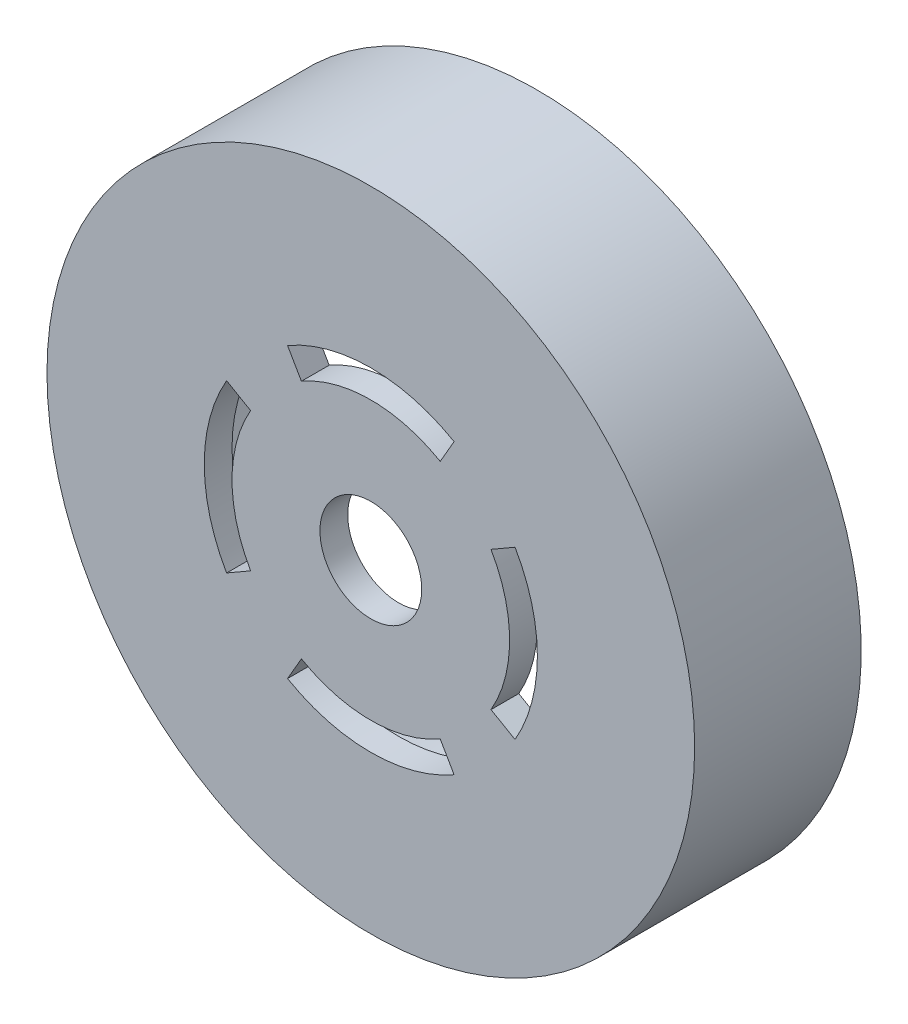
from build123d import *

# Parameters (mm, degrees)
SKETCH_2_R          = 35
SKETCH_2_R_2        = 5.5
EXTRUDE_1_DEPTH     = 5
EXTRUDE_START       = 15
SKETCH_3_R          = 35
SKETCH_3_R_2        = 30.1
EXTRUDE_2_DEPTH     = 15
SKETCH_4_R          = 1.55
CUT_EXTRUDE_1_DEPTH = 10
CUT_EXTRUDE_5_DEPTH = 15
FILLET_1_R          = 1
CUT_EXTRUDE_START   = -2
SKETCH_10_R         = 35
CUT_EXTRUDE_6_DEPTH = 2
CUT_EXTRUDE_7_DEPTH = 10


with BuildPart() as part:
    # 草图2 → 凸台-拉伸1 (new body)
    with BuildSketch(Plane.XY):
        Circle(SKETCH_2_R)
        Circle(SKETCH_2_R_2, mode=Mode.SUBTRACT)
    extrude(amount=EXTRUDE_1_DEPTH)

    # 草图3 → 凸台-拉伸2 (add)
    with BuildSketch(Plane(origin=(0, 0, 0), x_dir=(-1, 0, 0), z_dir=(0, 0, -1)).offset(EXTRUDE_START)):
        Circle(SKETCH_3_R)
        Circle(SKETCH_3_R_2, mode=Mode.SUBTRACT)
    extrude(amount=-EXTRUDE_2_DEPTH)

    # 草图4 → 切除-拉伸1 (cut)
    with BuildSketch(Plane(origin=(0, 0, -15), x_dir=(-1, 0, 0), z_dir=(0, 0, -1))):
        with Locations((0, 32.5)):
            Circle(SKETCH_4_R)
        with Locations((32.5, 0)):
            Circle(SKETCH_4_R)
        with Locations((0, -32.5)):
            Circle(SKETCH_4_R)
        with Locations((-32.5, 0)):
            Circle(SKETCH_4_R)
    extrude(amount=-CUT_EXTRUDE_1_DEPTH, mode=Mode.SUBTRACT)

    # 草图9 → 切除-拉伸5 (cut)
    with BuildSketch(Plane(origin=(0, 0, -15), x_dir=(-1, 0, 0), z_dir=(0, 0, -1))):
        with BuildLine():
            ThreePointArc((-22.013313369, 20.528615017), (-22.026376234, 22.026376234), (-20.528615017, 22.013313369))
            ThreePointArc((-20.528615017, 22.013313369), (-21.283914114, 21.283914114), (-22.013313369, 20.528615017))
        make_face()
        with BuildLine():
            ThreePointArc((20.528615017, 22.013313369), (22.026376234, 22.026376234), (22.013313369, 20.528615017))
            ThreePointArc((22.013313369, 20.528615017), (21.283914114, 21.283914114), (20.528615017, 22.013313369))
        make_face()
        with BuildLine():
            ThreePointArc((22.013313369, -20.528615017), (22.026376234, -22.026376234), (20.528615017, -22.013313369))
            ThreePointArc((20.528615017, -22.013313369), (21.283914114, -21.283914114), (22.013313369, -20.528615017))
        make_face()
        with BuildLine():
            ThreePointArc((-20.528615017, -22.013313369), (-22.026376234, -22.026376234), (-22.013313369, -20.528615017))
            ThreePointArc((-22.013313369, -20.528615017), (-21.283914114, -21.283914114), (-20.528615017, -22.013313369))
        make_face()
    extrude(amount=-CUT_EXTRUDE_5_DEPTH, mode=Mode.SUBTRACT)

    # 圆角1
    # the kernel refuses this fillet: 1 mm, written as the material it takes off along each edge
    with BuildSketch(Plane(origin=(0, 0, -15), x_dir=(-0.7403558797037455, 0.6722151228498904, 0), z_dir=(-0.6722151228498904, -0.7403558797037455, 0))) as fillet_1_piece_1:
        with BuildLine():
            CenterArc((30.1 + FILLET_1_R, -FILLET_1_R), FILLET_1_R, 90, 90)
            Line((30.1, -FILLET_1_R), (30.1, 0))
            Line((30.1, 0), (30.1 + FILLET_1_R, 0))
        make_face()
    revolve(axis=Axis((0, 0, -15), (0, 0, -1)), revolution_arc=95.523479776, mode=Mode.SUBTRACT)
    with BuildSketch(Plane(origin=(0, 0, -15), x_dir=(0.6722151228498918, 0.7403558797037441, 0), z_dir=(-0.7403558797037441, 0.6722151228498918, 0))) as fillet_1_piece_2:
        with BuildLine():
            CenterArc((30.1 + FILLET_1_R, -FILLET_1_R), FILLET_1_R, 90, 90)
            Line((30.1, -FILLET_1_R), (30.1, 0))
            Line((30.1, 0), (30.1 + FILLET_1_R, 0))
        make_face()
    revolve(axis=Axis((0, 0, -15), (0, 0, -1)), revolution_arc=95.523479776, mode=Mode.SUBTRACT)
    with BuildSketch(Plane(origin=(0, 0, -15), x_dir=(0.7403558797037453, -0.6722151228498905, 0), z_dir=(0.6722151228498905, 0.7403558797037453, 0))) as fillet_1_piece_3:
        with BuildLine():
            CenterArc((30.1 + FILLET_1_R, -FILLET_1_R), FILLET_1_R, 90, 90)
            Line((30.1, -FILLET_1_R), (30.1, 0))
            Line((30.1, 0), (30.1 + FILLET_1_R, 0))
        make_face()
    revolve(axis=Axis((0, 0, -15), (0, 0, -1)), revolution_arc=95.523479776, mode=Mode.SUBTRACT)
    with BuildSketch(Plane(origin=(0, 0, -15), x_dir=(-1, 0, 0), z_dir=(0, -1, 0))) as fillet_1_piece_4:
        with BuildLine():
            CenterArc((30.1 + FILLET_1_R, -FILLET_1_R), FILLET_1_R, 90, 90)
            Line((30.1, -FILLET_1_R), (30.1, 0))
            Line((30.1, 0), (30.1 + FILLET_1_R, 0))
        make_face()
    revolve(axis=Axis((0, 0, -15), (0, 0, -1)), revolution_arc=47.760430641, mode=Mode.SUBTRACT)
    with BuildSketch(Plane(origin=(0, 0, -15), x_dir=(-0.6722320403041436, -0.7403405189428228, 0), z_dir=(0.7403405189428228, -0.6722320403041436, 0))) as fillet_1_piece_5:
        with BuildLine():
            CenterArc((30.1 + FILLET_1_R, -FILLET_1_R), FILLET_1_R, 90, 90)
            Line((30.1, -FILLET_1_R), (30.1, 0))
            Line((30.1, 0), (30.1 + FILLET_1_R, 0))
        make_face()
    revolve(axis=Axis((0, 0, -15), (0, 0, -1)), revolution_arc=47.760430641, mode=Mode.SUBTRACT)

    # 草图10 → 切除-拉伸6 (cut)
    with BuildSketch(Plane.XY.offset(5).offset(CUT_EXTRUDE_START)):
        with Locations(Location((0, 0, 0), (0, 0, 180))):
            Circle(SKETCH_10_R)
    extrude(amount=CUT_EXTRUDE_6_DEPTH, mode=Mode.SUBTRACT)

    # 草图11 → 切除-拉伸7 (cut)
    with BuildSketch(Plane(origin=(0, 0, 0), x_dir=(-1, 0, 0), z_dir=(0, 0, -1))):
        with BuildLine():
            Line((12.990381057, 7.5), (15.588457268, 9))
            ThreePointArc((15.588457268, 9), (18, 0), (15.588457268, -9))
            Line((15.588457268, -9), (12.990381057, -7.5))
            ThreePointArc((12.990381057, -7.5), (15, 0), (12.990381057, 7.5))
        make_face()
        with BuildLine():
            Line((-7.5, 12.990381057), (-9, 15.588457268))
            ThreePointArc((-9, 15.588457268), (0, 18), (9, 15.588457268))
            Line((9, 15.588457268), (7.5, 12.990381057))
            ThreePointArc((7.5, 12.990381057), (0, 15), (-7.5, 12.990381057))
        make_face()
        with BuildLine():
            Line((7.5, -12.990381057), (9, -15.588457268))
            ThreePointArc((9, -15.588457268), (0, -18), (-9, -15.588457268))
            Line((-9, -15.588457268), (-7.5, -12.990381057))
            ThreePointArc((-7.5, -12.990381057), (0, -15), (7.5, -12.990381057))
        make_face()
        with BuildLine():
            Line((-12.990381057, -7.5), (-15.588457268, -9))
            ThreePointArc((-15.588457268, -9), (-18, 0), (-15.588457268, 9))
            Line((-15.588457268, 9), (-12.990381057, 7.5))
            ThreePointArc((-12.990381057, 7.5), (-15, 0), (-12.990381057, -7.5))
        make_face()
    extrude(amount=-CUT_EXTRUDE_7_DEPTH, mode=Mode.SUBTRACT)


solid = part.part
